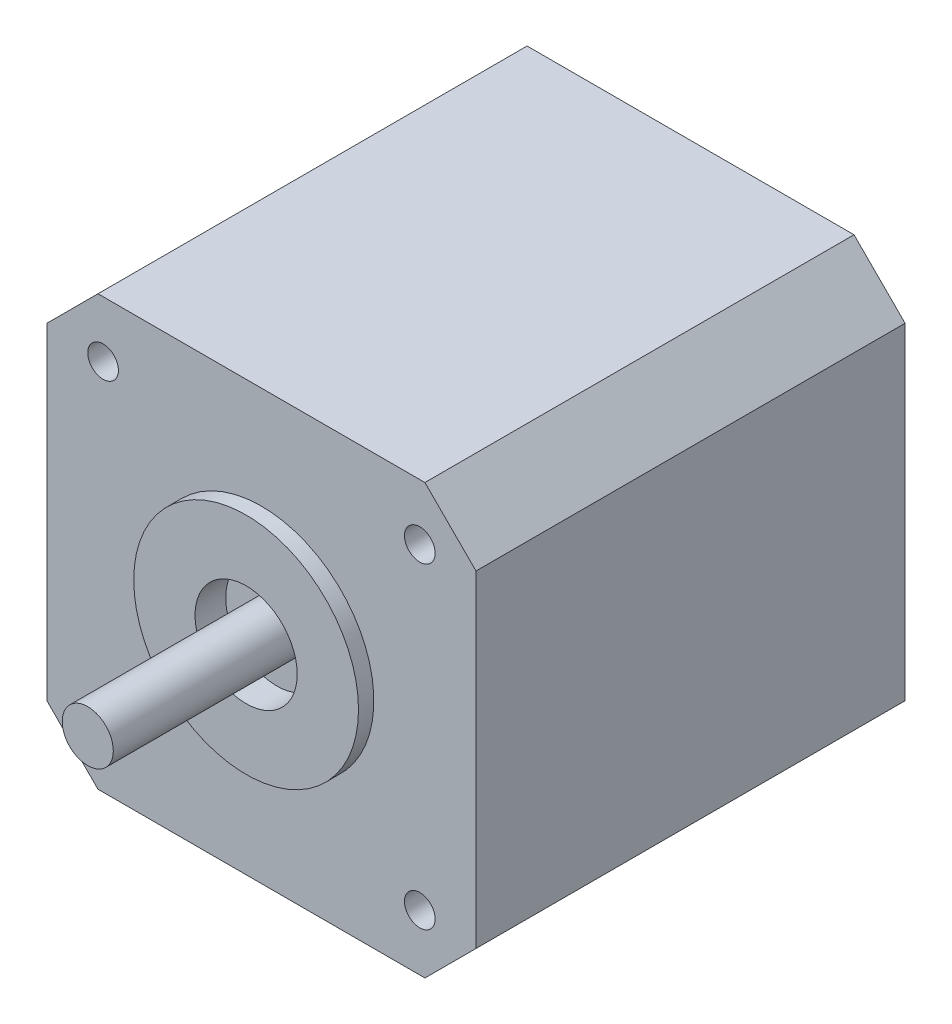
from build123d import *

# Parameters (mm, degrees)
SKETCH1_W           = 42
SKETCH1_H           = 42
BOSS_EXTRUDE1_DEPTH = 42
SKETCH2_R           = 1.5
CUT_EXTRUDE1_DEPTH  = 42
SKETCH3_R           = 11
BOSS_EXTRUDE2_DEPTH = 1.5
SKETCH4_R           = 5
CUT_EXTRUDE2_DEPTH  = 3
SKETCH5_R           = 2.5
BOSS_EXTRUDE3_DEPTH = 18.5
SKETCH6_R           = 3
CUT_EXTRUDE3_DEPTH  = 2
CHAMFER1_SIZE       = 5
CHAMFER2_SIZE       = 5
CHAMFER3_SIZE       = 5
CHAMFER4_SIZE       = 5


with BuildPart() as part:
    # Sketch1 → Boss-Extrude1 (new body)
    with BuildSketch(Plane(origin=(0, 0, 0), x_dir=(1, 0, 0), z_dir=(0, 1, 0))):
        Rectangle(SKETCH1_W, SKETCH1_H)
    extrude(amount=BOSS_EXTRUDE1_DEPTH)

    # Sketch2 → Cut-Extrude1 (cut)
    with BuildSketch(Plane.XY.offset(21)):
        with Locations((15.5, 36.5)):
            Circle(SKETCH2_R)
        with Locations((-15.5, 36.5)):
            Circle(SKETCH2_R)
        with Locations((15.5, 5.5)):
            Circle(SKETCH2_R)
        with Locations((-15.5, 5.5)):
            Circle(SKETCH2_R)
    extrude(amount=-CUT_EXTRUDE1_DEPTH, mode=Mode.SUBTRACT)

    # Sketch3 → Boss-Extrude2 (add)
    with BuildSketch(Plane.XY.offset(21)):
        with Locations((0, 21)):
            Circle(SKETCH3_R)
    extrude(amount=BOSS_EXTRUDE2_DEPTH)

    # Sketch4 → Cut-Extrude2 (cut)
    with BuildSketch(Plane.XY.offset(22.5)):
        with Locations((0, 21)):
            Circle(SKETCH4_R)
    extrude(amount=-CUT_EXTRUDE2_DEPTH, mode=Mode.SUBTRACT)

    # Sketch5 → Boss-Extrude3 (add)
    with BuildSketch(Plane.XY.offset(19.5)):
        with Locations((0, 21)):
            Circle(SKETCH5_R)
    extrude(amount=BOSS_EXTRUDE3_DEPTH)

    # Sketch6 → Cut-Extrude3 (cut)
    with BuildSketch(Plane(origin=(0, 0, -21), x_dir=(-1, 0, 0), z_dir=(0, 0, -1))):
        with Locations((15.5, 5.5)):
            Circle(SKETCH6_R)
        with Locations((15.5, 36.5)):
            Circle(SKETCH6_R)
        with Locations((-15.5, 5.5)):
            Circle(SKETCH6_R)
        with Locations((-15.5, 36.5)):
            Circle(SKETCH6_R)
    extrude(amount=-CUT_EXTRUDE3_DEPTH, mode=Mode.SUBTRACT)

    # Chamfer1
    chamfer1_edges = [part.edges().sort_by_distance(p)[0] for p in [
        (21, 42, 0),
    ]]
    chamfer(chamfer1_edges, length=CHAMFER1_SIZE)

    # Chamfer2
    chamfer2_edges = [part.edges().sort_by_distance(p)[0] for p in [
        (-21, 42, 0),
    ]]
    chamfer(chamfer2_edges, length=CHAMFER2_SIZE)

    # Chamfer3
    chamfer3_edges = [part.edges().sort_by_distance(p)[0] for p in [
        (-21, 0, 0),
    ]]
    chamfer(chamfer3_edges, length=CHAMFER3_SIZE)

    # Chamfer4
    chamfer4_edges = [part.edges().sort_by_distance(p)[0] for p in [
        (21, 0, 0),
    ]]
    chamfer(chamfer4_edges, length=CHAMFER4_SIZE)


solid = part.part
